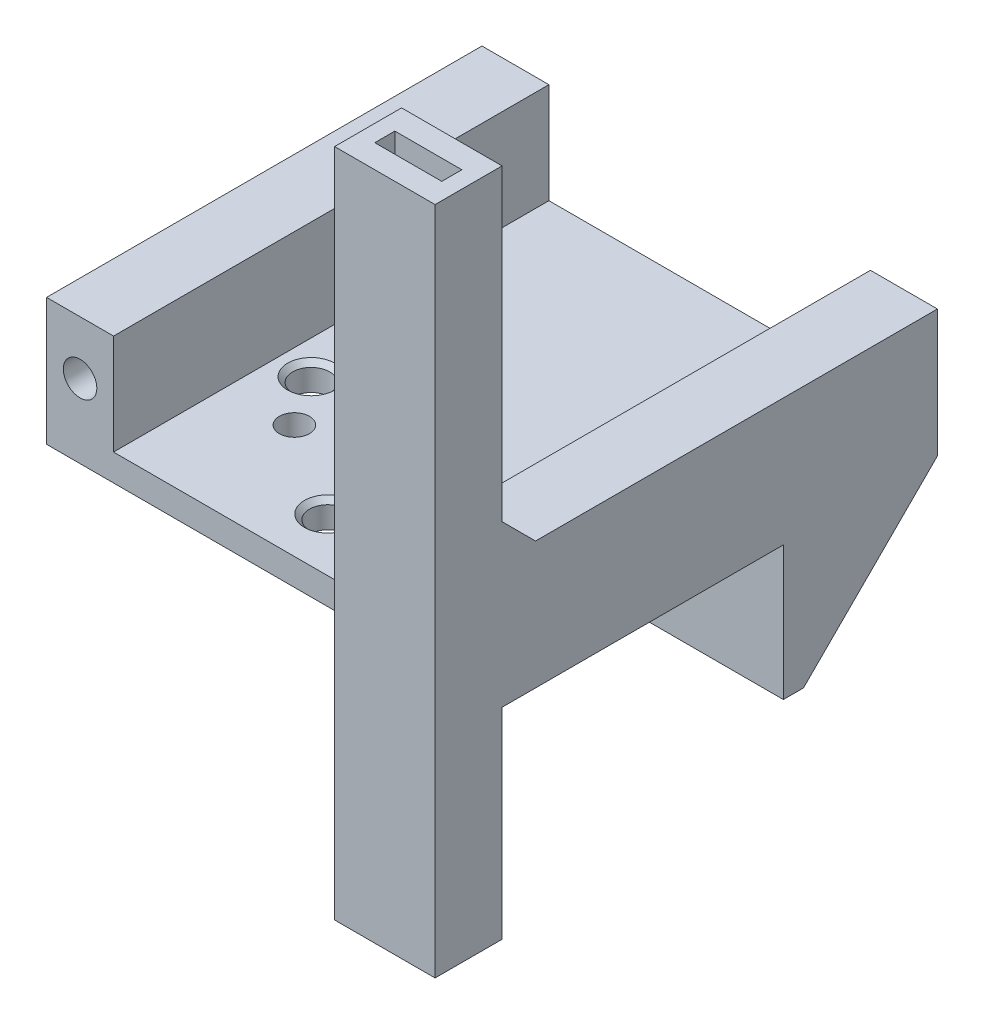
from build123d import *

# Parameters (mm, degrees)
SKETCH1_R                = 2.75
SKETCH1_R_2              = 2.25
BOSS_EXTRUDE1_DEPTH      = 4
SKETCH3_W                = 10
SKETCH3_H                = 42
BOSS_EXTRUDE3_DEPTH      = 15
SKETCH4_R                = 2.5
CUT_EXTRUDE1_DEPTH       = 58.280013966
CHAMFER1_SIZE            = 0.75
BOSS_EXTRUDE5_DEPTH      = 30
BOSS_EXTRUDE5_DEPTH_BACK = 70
SKETCH8_W                = 15
SKETCH8_H                = 10
SKETCH10_W               = 10
SKETCH10_H               = 3
CUT_EXTRUDE4_DEPTH       = 113.942463228
BOSS_EXTRUDE6_START      = 23
SKETCH11_W               = 10
SKETCH11_H               = 19
SKETCH11_R               = 2.5
BOSS_EXTRUDE6_DEPTH      = 23
BOSS_EXTRUDE7_DEPTH      = 3
BOSS_EXTRUDE8_DEPTH      = 10
BOSS_EXTRUDE9_DEPTH      = 10
CHAMFER2_SIZE            = 5
CHAMFER3_SIZE            = 10
CHAMFER4_SIZE            = 5
BOSS_EXTRUDE10_REACH     = 112.603


with BuildPart() as part:
    # Sketch1 → Boss-Extrude1 (new body)
    with BuildSketch(Plane(origin=(0, 0, 0), x_dir=(1, 0, 0), z_dir=(0, 1, 0))):
        Polygon((-34, 0), (-34, 40), (34, 40), (34, 0), (34, -2), (-34, -2), align=None)
        with Locations(Location((-19, 22.5, 0), (0, 0, 270))):
            Circle(SKETCH1_R, mode=Mode.SUBTRACT)
        with Locations(Location((19, 22.5, 0), (0, 0, 270))):
            Circle(SKETCH1_R, mode=Mode.SUBTRACT)
        with Locations(Location((-14, 15, 0), (0, 0, 270))):
            Circle(SKETCH1_R_2, mode=Mode.SUBTRACT)
        with Locations(Location((14, 15, 0), (0, 0, 270))):
            Circle(SKETCH1_R_2, mode=Mode.SUBTRACT)
        with Locations(Location((0, 6, 0), (0, 0, 270))):
            Circle(SKETCH1_R, mode=Mode.SUBTRACT)
    extrude(amount=BOSS_EXTRUDE1_DEPTH)

    # Sketch3 → Boss-Extrude3 (add)
    with BuildSketch(Plane(origin=(0, 4, 0), x_dir=(1, 0, 0), z_dir=(0, 1, 0))):
        with Locations((-29, 19)):
            Rectangle(SKETCH3_W, SKETCH3_H)
        with Locations((29, 19)):
            Rectangle(SKETCH3_W, SKETCH3_H)
    extrude(amount=BOSS_EXTRUDE3_DEPTH)

    # Sketch4 → Cut-Extrude1 (cut, through all)
    with BuildSketch(Plane(origin=(0, 0, -40), x_dir=(-1, 0, 0), z_dir=(0, 0, -1))):
        with Locations((-29, 11)):
            Circle(SKETCH4_R)
        with Locations((29, 11)):
            Circle(SKETCH4_R)
    extrude(amount=-CUT_EXTRUDE1_DEPTH, mode=Mode.SUBTRACT)

    # Chamfer1
    chamfer1_edges = [part.edges().sort_by_distance(p)[0] for p in [
        (-19, 4, -25.25),
        (19, 4, -25.25),
        (0, 4, -8.75),
    ]]
    chamfer(chamfer1_edges, length=CHAMFER1_SIZE)

    # Sketch8 → Boss-Extrude5 (add, two sides: drawn at the far end of the back side and taken through both)
    with BuildSketch(Plane.XZ.offset(-BOSS_EXTRUDE5_DEPTH_BACK)):
        with Locations((26.5, 7)):
            Rectangle(SKETCH8_W, SKETCH8_H)
    extrude(amount=BOSS_EXTRUDE5_DEPTH + BOSS_EXTRUDE5_DEPTH_BACK)

    # Sketch10 → Cut-Extrude4 (cut, through all)
    with BuildSketch(Plane(origin=(0, 70, 0), x_dir=(1, 0, 0), z_dir=(0, 1, 0))):
        with Locations((26.5, -7)):
            Rectangle(SKETCH10_W, SKETCH10_H)
    extrude(amount=-CUT_EXTRUDE4_DEPTH, mode=Mode.SUBTRACT)

    # Sketch11 → Boss-Extrude6 (add)
    # profile 1 of 2: a face of its own
    with BuildSketch(Plane(origin=(0, 0, -40), x_dir=(-1, 0, 0), z_dir=(0, 0, -1)).offset(BOSS_EXTRUDE6_START)):
        with Locations((-29, 9.5)):
            Rectangle(SKETCH11_W, SKETCH11_H)
        with Locations((-29, 11)):
            Circle(SKETCH11_R, mode=Mode.SUBTRACT)
    # profile 2 of 2: a face of its own
    with BuildSketch(Plane(origin=(0, 0, -40), x_dir=(-1, 0, 0), z_dir=(0, 0, -1)).offset(BOSS_EXTRUDE6_START)):
        with Locations((29, 9.5)):
            Rectangle(SKETCH11_W, SKETCH11_H)
        with Locations((29, 11)):
            Circle(SKETCH11_R, mode=Mode.SUBTRACT)
    extrude(amount=-BOSS_EXTRUDE6_DEPTH)

    # Sketch12 → Boss-Extrude7 (add)
    with BuildSketch(Plane(origin=(0, 0, -40), x_dir=(-1, 0, 0), z_dir=(0, 0, -1))):
        Polygon((-24, 0), (-24, 4), (24, 4), (24, 0), (34, 0), (34, -20), (-34, -20), (-34, 0), align=None)
    extrude(amount=BOSS_EXTRUDE7_DEPTH)

    # Sketch13 → Boss-Extrude8 (add)
    with BuildSketch(Plane.ZY.offset(34)):
        Polygon((-63, 0), (-43, -20), (-43, 0), align=None)
    extrude(amount=-BOSS_EXTRUDE8_DEPTH)

    # Sketch14 → Boss-Extrude9 (add)
    with BuildSketch(Plane(origin=(34, 0, 0), x_dir=(0, 0, -1), z_dir=(1, 0, 0))):
        Polygon((43, 0), (43, -20), (63, 0), align=None)
    extrude(amount=-BOSS_EXTRUDE9_DEPTH)

    # Chamfer2
    chamfer2_edges = [part.edges().sort_by_distance(p)[0] for p in [
        (24, 11.5, 2),
    ]]
    chamfer(chamfer2_edges, length=CHAMFER2_SIZE - 0.0001)  # a hair under: the kernel refuses the full size

    # Chamfer3
    chamfer3_edges = [part.edges().sort_by_distance(p)[0] for p in [
        (19, 2, 2),
    ]]
    chamfer(chamfer3_edges, length=CHAMFER3_SIZE - 0.0001)  # a hair under: the kernel refuses the full size

    # Chamfer4
    chamfer4_edges = [part.edges().sort_by_distance(p)[0] for p in [
        (26.50005, 19, 2),
    ]]
    chamfer(chamfer4_edges, length=CHAMFER4_SIZE)

    # Sketch15 → Boss-Extrude10 (add, up to next)
    with BuildSketch(Plane.ZY.offset(-24), mode=Mode.PRIVATE) as boss_extrude10_sk1:
        Polygon((-43, -20), (-43, 4), (-63, 4), (-63, 0), align=None)
    boss_extrude10_tool1 = extrude(boss_extrude10_sk1.sketch, amount=BOSS_EXTRUDE10_REACH, mode=Mode.PRIVATE) - part.part
    add(boss_extrude10_tool1.solids().sort_by_distance((24, -4.190476, -50.619048))[0])


solid = part.part
